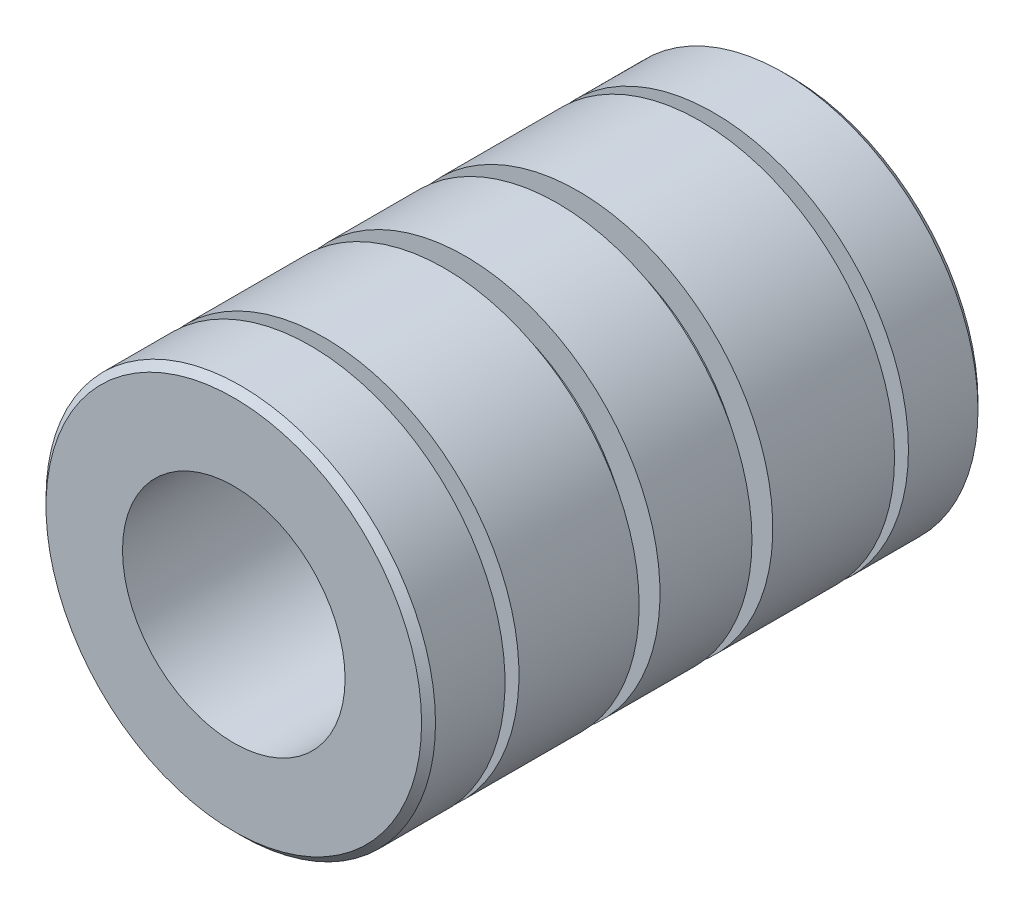
from build123d import *

# Parameters (mm, degrees)
SKETCH2_R           = 11.1125
BOSS_EXTRUDE1_DEPTH = 31.75
SKETCH3_R           = 6.35
CUT_EXTRUDE1_DEPTH  = 36.426512847
SKETCH4_W           = 3.175
SKETCH4_H           = 0.79375
CHAMFER1_SIZE       = 0.396875
SKETCH5_W           = 3.175
SKETCH5_H           = 1.190625


with BuildPart() as part:
    # Sketch2 → Boss-Extrude1 (new body)
    with BuildSketch(Plane.XY):
        Circle(SKETCH2_R)
    extrude(amount=BOSS_EXTRUDE1_DEPTH)

    # Sketch3 → Cut-Extrude1 (cut, through all)
    with BuildSketch(Plane.XY.offset(31.75)):
        Circle(SKETCH3_R)
    extrude(amount=-CUT_EXTRUDE1_DEPTH, mode=Mode.SUBTRACT)

    # Sketch4 → Cut-Revolve1 (revolve, cut)
    with BuildSketch(Plane(origin=(0, 0, 0), x_dir=(1, 0, 0), z_dir=(0, 1, 0))):
        with Locations((11.1125, -26.9875)):
            Rectangle(SKETCH4_W, SKETCH4_H)
        with Locations((11.1125, -4.7625)):
            Rectangle(SKETCH4_W, SKETCH4_H)
    revolve(axis=Axis((0, 0, 31.75), (0, 0, -1)), mode=Mode.SUBTRACT)

    # Chamfer1
    chamfer1_edges = [part.edges().sort_by_distance(p)[0] for p in [
        (-11.1125, 0, 0),
        (-11.1125, 0, 31.75),
    ]]
    chamfer(chamfer1_edges, length=CHAMFER1_SIZE)

    # Sketch5 → Cut-Revolve2 (revolve, cut)
    with BuildSketch(Plane(origin=(0, 0, 0), x_dir=(1, 0, 0), z_dir=(0, 1, 0))):
        with Locations((11.1125, -12.7)):
            Rectangle(SKETCH5_W, SKETCH5_H)
        with Locations((11.1125, -19.137777624)):
            Rectangle(SKETCH5_W, SKETCH5_H)
    revolve(axis=Axis((0, 0, 31.75), (0, 0, -1)), mode=Mode.SUBTRACT)


solid = part.part
